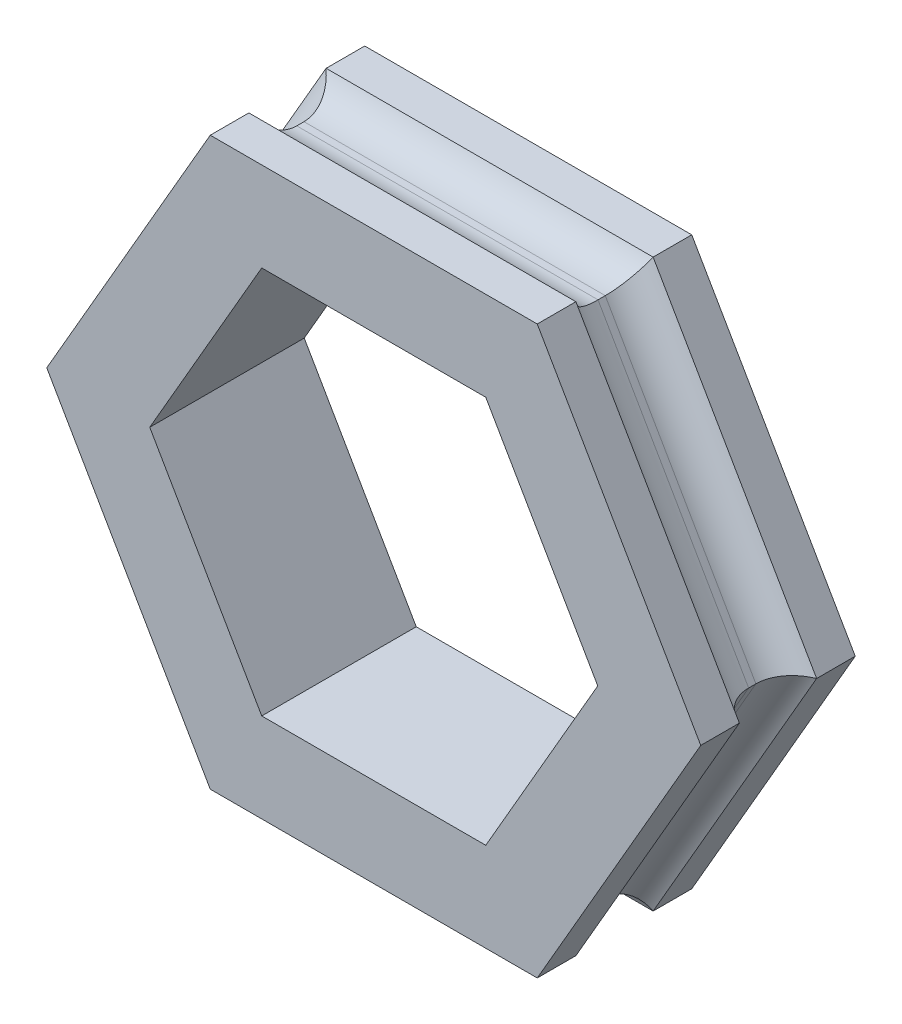
from build123d import *

# Parameters (mm, degrees)
BOSS_EXTRUDE2_DEPTH      = 1.5
BOSS_EXTRUDE2_DEPTH_BACK = 1.5
CUT_EXTRUDE1_DEPTH       = 0.75
CUT_EXTRUDE1_DEPTH_BACK  = 0.75
FILLET1_R                = 0.75


with BuildPart() as part:
    # Sketch1 → Boss-Extrude2 (new, two sides: drawn at the far end of the back side and taken through both)
    # profile 1 of 2: a face of its own
    with BuildSketch(Plane.XY.offset(-BOSS_EXTRUDE2_DEPTH_BACK)):
        Polygon((-3.175, -5.499261314), (3.175, -5.499261314), (6.35, 0), (3.175, 5.499261314), (-3.175, 5.499261314), (-6.35, 0), align=None)
        Polygon((2.925, -5.066248612), (5.85, 0), (2.925, 5.066248612), (-2.925, 5.066248612), (-5.85, 0), (-2.925, -5.066248612), align=None, mode=Mode.SUBTRACT)
    # profile 2 of 2: a face of its own
    with BuildSketch(Plane.XY.offset(-BOSS_EXTRUDE2_DEPTH_BACK)):
        Polygon((-2.925, -5.066248612), (2.925, -5.066248612), (5.85, 0), (2.925, 5.066248612), (-2.925, 5.066248612), (-5.85, 0), align=None)
        Polygon((2.175, -3.767210506), (4.35, 0), (2.175, 3.767210506), (-2.175, 3.767210506), (-4.35, 0), (-2.175, -3.767210506), align=None, mode=Mode.SUBTRACT)
    extrude(amount=BOSS_EXTRUDE2_DEPTH + BOSS_EXTRUDE2_DEPTH_BACK)

    # Sketch1<4> → Cut-Extrude1 (cut, two sides: drawn at the far end of the back side and taken through both)
    with BuildSketch(Plane.XY.offset(-CUT_EXTRUDE1_DEPTH_BACK)):
        Polygon((-3.175, -5.499261314), (3.175, -5.499261314), (6.35, 0), (3.175, 5.499261314), (-3.175, 5.499261314), (-6.35, 0), align=None)
        Polygon((2.925, -5.066248612), (5.85, 0), (2.925, 5.066248612), (-2.925, 5.066248612), (-5.85, 0), (-2.925, -5.066248612), align=None, mode=Mode.SUBTRACT)
    extrude(amount=CUT_EXTRUDE1_DEPTH + CUT_EXTRUDE1_DEPTH_BACK, mode=Mode.SUBTRACT)

    # Fillet1
    # the kernel refuses this fillet: 0.75 mm, written as the material it adds along each edge
    with BuildSketch(Plane(origin=(2.075350207, -6.537885222, 0.75), x_dir=(0.8660254037844385, -0.5000000000000001, 0), z_dir=(0.5000000000000001, 0.8660254037844387, 0))) as fillet1_piece_1_section:
        with BuildLine():
            CenterArc((0.75, 0.679719834), FILLET1_R, 180, 64.998010544)
            Line((0, 0.679719834), (0, 0))
            Line((0, 0), (0.433012702, 0))
        make_face()
    fillet1_piece_1 = extrude(amount=9.24859917, mode=Mode.PRIVATE)
    fillet1_piece_1 = split(fillet1_piece_1, bisect_by=Plane(origin=(2.075350207, -5.499261314, 0.75), z_dir=(0, 1, 0)), keep=Keep.TOP, mode=Mode.PRIVATE)
    fillet1_piece_1 = split(fillet1_piece_1, bisect_by=Plane(origin=(8.112324896, -3.05243626, 0.75), z_dir=(-0.8660254037844386, -0.5000000000000002, 0)), keep=Keep.TOP, mode=Mode.PRIVATE)
    fillet1_piece_1 = fillet1_piece_1 - Plane(origin=(2.075350207, -5.816248612, 0.070280166), x_dir=(0, 0.42264973081037627, 0.9062931121033175), z_dir=(-1, 0, 0)) * Cylinder(0.75, 22, mode=Mode.PRIVATE)
    fillet1_piece_1 = fillet1_piece_1 - Plane(origin=(8.386843949, -2.893942611, 0.070280166), x_dir=(-0.3660254037844377, -0.21132486540518658, 0.9062931121033191), z_dir=(0.5000000000000001, -0.8660254037844386, 0)) * Cylinder(0.75, 22, mode=Mode.PRIVATE)
    add(fillet1_piece_1)
    with BuildSketch(Plane(origin=(-4.624299585, -5.066248612, 0.75), x_dir=(0, -1, 0), z_dir=(1, 0, 0))) as fillet1_piece_2_section:
        with BuildLine():
            CenterArc((0.75, 0.679719834), FILLET1_R, 180, 64.998010544)
            Line((0, 0.679719834), (0, 0))
            Line((0, 0), (0.433012702, 0))
        make_face()
    fillet1_piece_2 = extrude(amount=9.24859917, mode=Mode.PRIVATE)
    fillet1_piece_2 = split(fillet1_piece_2, bisect_by=Plane(origin=(-3.724824896, -4.546936658, 0.75), z_dir=(0.8660254037844386, 0.5000000000000001, 0)), keep=Keep.TOP, mode=Mode.PRIVATE)
    fillet1_piece_2 = split(fillet1_piece_2, bisect_by=Plane(origin=(1.412675104, -8.551697574, 0.75), z_dir=(-0.8660254037844389, 0.4999999999999995, 0)), keep=Keep.TOP, mode=Mode.PRIVATE)
    fillet1_piece_2 = fillet1_piece_2 - Plane(origin=(1.687194157, -8.710191223, 0.070280166), x_dir=(-0.3660254037844373, 0.21132486540518636, 0.9062931121033192), z_dir=(-0.5000000000000001, -0.8660254037844386, 0)) * Cylinder(0.75, 22, mode=Mode.PRIVATE)
    fillet1_piece_2 = fillet1_piece_2 - Plane(origin=(-3.999343949, -4.705430307, 0.070280166), x_dir=(0.3660254037844385, 0.21132486540518705, 0.9062931121033185), z_dir=(-0.5000000000000001, 0.8660254037844386, 0)) * Cylinder(0.75, 22, mode=Mode.PRIVATE)
    add(fillet1_piece_2)
    with BuildSketch(Plane(origin=(-6.699649793, 1.471636609, 0.75), x_dir=(-0.8660254037844386, -0.5000000000000001, 0), z_dir=(0.5000000000000001, -0.8660254037844387, 0))) as fillet1_piece_3_section:
        with BuildLine():
            CenterArc((0.75, 0.679719834), FILLET1_R, 180, 64.998010544)
            Line((0, 0.679719834), (0, 0))
            Line((0, 0), (0.433012702, 0))
        make_face()
    fillet1_piece_3 = extrude(amount=9.24859917, mode=Mode.PRIVATE)
    fillet1_piece_3 = split(fillet1_piece_3, bisect_by=Plane(origin=(-6.699649793, -5.499261314, 0.75), z_dir=(0, 1, 0)), keep=Keep.TOP, mode=Mode.PRIVATE)
    fillet1_piece_3 = split(fillet1_piece_3, bisect_by=Plane(origin=(-5.800175104, 0.952324656, 0.75), z_dir=(0.8660254037844388, -0.4999999999999999, 0)), keep=Keep.TOP, mode=Mode.PRIVATE)
    fillet1_piece_3 = fillet1_piece_3 - Plane(origin=(-6.699649793, -5.816248612, 0.070280166), x_dir=(0, 0.42264973081037627, 0.9062931121033175), z_dir=(-1, 0, 0)) * Cylinder(0.75, 22, mode=Mode.PRIVATE)
    fillet1_piece_3 = fillet1_piece_3 - Plane(origin=(-6.074694157, 1.110818305, 0.070280166), x_dir=(0.36602540378443843, -0.21132486540518683, 0.9062931121033186), z_dir=(0.49999999999999967, 0.8660254037844388, 0)) * Cylinder(0.75, 22, mode=Mode.PRIVATE)
    add(fillet1_piece_3)
    with BuildSketch(Plane(origin=(-2.075350207, 6.537885222, 0.75), x_dir=(-0.8660254037844388, 0.49999999999999967, 0), z_dir=(-0.4999999999999997, -0.8660254037844388, 0))) as fillet1_piece_4_section:
        with BuildLine():
            CenterArc((0.75, 0.679719834), FILLET1_R, 180, 64.998010544)
            Line((0, 0.679719834), (0, 0))
            Line((0, 0), (0.433012702, 0))
        make_face()
    fillet1_piece_4 = extrude(amount=9.24859917, mode=Mode.PRIVATE)
    fillet1_piece_4 = split(fillet1_piece_4, bisect_by=Plane(origin=(-8.112324896, 3.05243626, 0.75), z_dir=(0.8660254037844386, 0.5000000000000001, 0)), keep=Keep.TOP, mode=Mode.PRIVATE)
    fillet1_piece_4 = split(fillet1_piece_4, bisect_by=Plane(origin=(-2.075350207, 5.499261314, 0.75), z_dir=(0, -1, 0)), keep=Keep.TOP, mode=Mode.PRIVATE)
    fillet1_piece_4 = fillet1_piece_4 - Plane(origin=(-8.386843949, 2.893942611, 0.070280166), x_dir=(0.3660254037844385, 0.21132486540518705, 0.9062931121033185), z_dir=(-0.5000000000000001, 0.8660254037844386, 0)) * Cylinder(0.75, 22, mode=Mode.PRIVATE)
    fillet1_piece_4 = fillet1_piece_4 - Plane(origin=(-2.075350207, 5.816248612, 0.070280166), x_dir=(0, -0.42264973081036916, 0.9062931121033209), z_dir=(1, 0, 0)) * Cylinder(0.75, 22, mode=Mode.PRIVATE)
    add(fillet1_piece_4)
    with BuildSketch(Plane(origin=(4.624299585, 5.066248612, 0.75), x_dir=(0, 1, 0), z_dir=(-1, 0, 0))) as fillet1_piece_5_section:
        with BuildLine():
            CenterArc((0.75, 0.679719834), FILLET1_R, 180, 64.998010544)
            Line((0, 0.679719834), (0, 0))
            Line((0, 0), (0.433012702, 0))
        make_face()
    fillet1_piece_5 = extrude(amount=9.24859917, mode=Mode.PRIVATE)
    fillet1_piece_5 = split(fillet1_piece_5, bisect_by=Plane(origin=(-1.412675104, 8.551697574, 0.75), z_dir=(0.8660254037844388, -0.4999999999999999, 0)), keep=Keep.TOP, mode=Mode.PRIVATE)
    fillet1_piece_5 = split(fillet1_piece_5, bisect_by=Plane(origin=(3.724824896, 4.546936658, 0.75), z_dir=(-0.8660254037844386, -0.5000000000000002, 0)), keep=Keep.TOP, mode=Mode.PRIVATE)
    fillet1_piece_5 = fillet1_piece_5 - Plane(origin=(-1.687194157, 8.710191223, 0.070280166), x_dir=(0.36602540378443843, -0.21132486540518683, 0.9062931121033186), z_dir=(0.49999999999999967, 0.8660254037844388, 0)) * Cylinder(0.75, 22, mode=Mode.PRIVATE)
    fillet1_piece_5 = fillet1_piece_5 - Plane(origin=(3.999343949, 4.705430307, 0.070280166), x_dir=(-0.3660254037844377, -0.21132486540518658, 0.9062931121033191), z_dir=(0.5000000000000001, -0.8660254037844386, 0)) * Cylinder(0.75, 22, mode=Mode.PRIVATE)
    add(fillet1_piece_5)
    with BuildSketch(Plane(origin=(6.699649793, -1.471636609, 0.75), x_dir=(0.8660254037844386, 0.5000000000000001, 0), z_dir=(-0.5000000000000001, 0.8660254037844387, 0))) as fillet1_piece_6_section:
        with BuildLine():
            CenterArc((0.75, 0.679719834), FILLET1_R, 180, 64.998010544)
            Line((0, 0.679719834), (0, 0))
            Line((0, 0), (0.433012702, 0))
        make_face()
    fillet1_piece_6 = extrude(amount=9.24859917, mode=Mode.PRIVATE)
    fillet1_piece_6 = split(fillet1_piece_6, bisect_by=Plane(origin=(5.800175104, -0.952324656, 0.75), z_dir=(-0.8660254037844389, 0.4999999999999995, 0)), keep=Keep.TOP, mode=Mode.PRIVATE)
    fillet1_piece_6 = split(fillet1_piece_6, bisect_by=Plane(origin=(6.699649793, 5.499261314, 0.75), z_dir=(0, -1, 0)), keep=Keep.TOP, mode=Mode.PRIVATE)
    fillet1_piece_6 = fillet1_piece_6 - Plane(origin=(6.074694157, -1.110818305, 0.070280166), x_dir=(-0.3660254037844373, 0.21132486540518636, 0.9062931121033192), z_dir=(-0.5000000000000001, -0.8660254037844386, 0)) * Cylinder(0.75, 22, mode=Mode.PRIVATE)
    fillet1_piece_6 = fillet1_piece_6 - Plane(origin=(6.699649793, 5.816248612, 0.070280166), x_dir=(0, -0.42264973081036916, 0.9062931121033209), z_dir=(1, 0, 0)) * Cylinder(0.75, 22, mode=Mode.PRIVATE)
    add(fillet1_piece_6)
    with BuildSketch(Plane(origin=(2.075350207, -6.537885222, -0.75), x_dir=(0, 0, 1), z_dir=(0.5000000000000001, 0.8660254037844387, 0))) as fillet1_piece_7_section:
        with BuildLine():
            CenterArc((0.679719834, 0.75), FILLET1_R, 205.001989456, 64.998010544)
            Line((0, 0.433012702), (0, 0))
            Line((0, 0), (0.679719834, 0))
        make_face()
    fillet1_piece_7 = extrude(amount=9.24859917, mode=Mode.PRIVATE)
    fillet1_piece_7 = split(fillet1_piece_7, bisect_by=Plane(origin=(2.075350207, -5.499261314, -0.75), z_dir=(0, 1, 0)), keep=Keep.TOP, mode=Mode.PRIVATE)
    fillet1_piece_7 = split(fillet1_piece_7, bisect_by=Plane(origin=(8.112324896, -3.05243626, -0.75), z_dir=(-0.8660254037844386, -0.5000000000000002, 0)), keep=Keep.TOP, mode=Mode.PRIVATE)
    fillet1_piece_7 = fillet1_piece_7 - Plane(origin=(8.386843949, -2.893942611, -0.070280166), x_dir=(-0.8660254037844387, -0.5000000000000001, 0), z_dir=(0.5000000000000001, -0.8660254037844387, 0)) * Cylinder(0.75, 22, mode=Mode.PRIVATE)
    fillet1_piece_7 = fillet1_piece_7 - Plane(origin=(2.075350207, -5.816248612, -0.070280166), x_dir=(0, 1, 0), z_dir=(-1, 0, 0)) * Cylinder(0.75, 22, mode=Mode.PRIVATE)
    add(fillet1_piece_7)
    with BuildSketch(Plane(origin=(6.699649793, -1.471636609, -0.75), x_dir=(0, 0, 1), z_dir=(-0.5000000000000001, 0.8660254037844387, 0))) as fillet1_piece_8_section:
        with BuildLine():
            CenterArc((0.679719834, 0.75), FILLET1_R, 205.001989456, 64.998010544)
            Line((0, 0.433012702), (0, 0))
            Line((0, 0), (0.679719834, 0))
        make_face()
    fillet1_piece_8 = extrude(amount=9.24859917, mode=Mode.PRIVATE)
    fillet1_piece_8 = split(fillet1_piece_8, bisect_by=Plane(origin=(5.800175104, -0.952324656, -0.75), z_dir=(-0.8660254037844389, 0.4999999999999995, 0)), keep=Keep.TOP, mode=Mode.PRIVATE)
    fillet1_piece_8 = split(fillet1_piece_8, bisect_by=Plane(origin=(6.699649793, 5.499261314, -0.75), z_dir=(0, -1, 0)), keep=Keep.TOP, mode=Mode.PRIVATE)
    fillet1_piece_8 = fillet1_piece_8 - Plane(origin=(6.074694157, -1.110818305, -0.070280166), x_dir=(-0.8660254037844387, 0.5000000000000001, 0), z_dir=(-0.5000000000000001, -0.8660254037844387, 0)) * Cylinder(0.75, 22, mode=Mode.PRIVATE)
    fillet1_piece_8 = fillet1_piece_8 - Plane(origin=(6.699649793, 5.816248612, -0.070280166), x_dir=(0, -1, 0), z_dir=(1, 0, 0)) * Cylinder(0.75, 22, mode=Mode.PRIVATE)
    add(fillet1_piece_8)
    with BuildSketch(Plane(origin=(4.624299585, 5.066248612, -0.75), x_dir=(0, 0, 1), z_dir=(-1, 0, 0))) as fillet1_piece_9_section:
        with BuildLine():
            CenterArc((0.679719834, 0.75), FILLET1_R, 205.001989456, 64.998010544)
            Line((0, 0.433012702), (0, 0))
            Line((0, 0), (0.679719834, 0))
        make_face()
    fillet1_piece_9 = extrude(amount=9.24859917, mode=Mode.PRIVATE)
    fillet1_piece_9 = split(fillet1_piece_9, bisect_by=Plane(origin=(3.724824896, 4.546936658, -0.75), z_dir=(-0.8660254037844386, -0.5000000000000002, 0)), keep=Keep.TOP, mode=Mode.PRIVATE)
    fillet1_piece_9 = split(fillet1_piece_9, bisect_by=Plane(origin=(-1.412675104, 8.551697574, -0.75), z_dir=(0.8660254037844388, -0.4999999999999999, 0)), keep=Keep.TOP, mode=Mode.PRIVATE)
    fillet1_piece_9 = fillet1_piece_9 - Plane(origin=(-1.687194157, 8.710191223, -0.070280166), x_dir=(0.8660254037844388, -0.4999999999999997, 0), z_dir=(0.4999999999999997, 0.8660254037844388, 0)) * Cylinder(0.75, 22, mode=Mode.PRIVATE)
    fillet1_piece_9 = fillet1_piece_9 - Plane(origin=(3.999343949, 4.705430307, -0.070280166), x_dir=(-0.8660254037844387, -0.5000000000000001, 0), z_dir=(0.5000000000000001, -0.8660254037844387, 0)) * Cylinder(0.75, 22, mode=Mode.PRIVATE)
    add(fillet1_piece_9)
    with BuildSketch(Plane(origin=(-2.075350207, 6.537885222, -0.75), x_dir=(0, 0, 1), z_dir=(-0.4999999999999997, -0.8660254037844388, 0))) as fillet1_piece_10_section:
        with BuildLine():
            CenterArc((0.679719834, 0.75), FILLET1_R, 205.001989456, 64.998010544)
            Line((0, 0.433012702), (0, 0))
            Line((0, 0), (0.679719834, 0))
        make_face()
    fillet1_piece_10 = extrude(amount=9.24859917, mode=Mode.PRIVATE)
    fillet1_piece_10 = split(fillet1_piece_10, bisect_by=Plane(origin=(-2.075350207, 5.499261314, -0.75), z_dir=(0, -1, 0)), keep=Keep.TOP, mode=Mode.PRIVATE)
    fillet1_piece_10 = split(fillet1_piece_10, bisect_by=Plane(origin=(-8.112324896, 3.05243626, -0.75), z_dir=(0.8660254037844386, 0.5000000000000001, 0)), keep=Keep.TOP, mode=Mode.PRIVATE)
    fillet1_piece_10 = fillet1_piece_10 - Plane(origin=(-8.386843949, 2.893942611, -0.070280166), x_dir=(0.8660254037844387, 0.5000000000000001, 0), z_dir=(-0.5000000000000001, 0.8660254037844387, 0)) * Cylinder(0.75, 22, mode=Mode.PRIVATE)
    fillet1_piece_10 = fillet1_piece_10 - Plane(origin=(-2.075350207, 5.816248612, -0.070280166), x_dir=(0, -1, 0), z_dir=(1, 0, 0)) * Cylinder(0.75, 22, mode=Mode.PRIVATE)
    add(fillet1_piece_10)
    with BuildSketch(Plane(origin=(-6.699649793, 1.471636609, -0.75), x_dir=(0, 0, 1), z_dir=(0.5000000000000001, -0.8660254037844387, 0))) as fillet1_piece_11_section:
        with BuildLine():
            CenterArc((0.679719834, 0.75), FILLET1_R, 205.001989456, 64.998010544)
            Line((0, 0.433012702), (0, 0))
            Line((0, 0), (0.679719834, 0))
        make_face()
    fillet1_piece_11 = extrude(amount=9.24859917, mode=Mode.PRIVATE)
    fillet1_piece_11 = split(fillet1_piece_11, bisect_by=Plane(origin=(-6.699649793, -5.499261314, -0.75), z_dir=(0, 1, 0)), keep=Keep.TOP, mode=Mode.PRIVATE)
    fillet1_piece_11 = split(fillet1_piece_11, bisect_by=Plane(origin=(-5.800175104, 0.952324656, -0.75), z_dir=(0.8660254037844388, -0.4999999999999999, 0)), keep=Keep.TOP, mode=Mode.PRIVATE)
    fillet1_piece_11 = fillet1_piece_11 - Plane(origin=(-6.074694157, 1.110818305, -0.070280166), x_dir=(0.8660254037844388, -0.4999999999999997, 0), z_dir=(0.4999999999999997, 0.8660254037844388, 0)) * Cylinder(0.75, 22, mode=Mode.PRIVATE)
    fillet1_piece_11 = fillet1_piece_11 - Plane(origin=(-6.699649793, -5.816248612, -0.070280166), x_dir=(0, 1, 0), z_dir=(-1, 0, 0)) * Cylinder(0.75, 22, mode=Mode.PRIVATE)
    add(fillet1_piece_11)
    with BuildSketch(Plane(origin=(-4.624299585, -5.066248612, -0.75), x_dir=(0, 0, 1), z_dir=(1, 0, 0))) as fillet1_piece_12_section:
        with BuildLine():
            CenterArc((0.679719834, 0.75), FILLET1_R, 205.001989456, 64.998010544)
            Line((0, 0.433012702), (0, 0))
            Line((0, 0), (0.679719834, 0))
        make_face()
    fillet1_piece_12 = extrude(amount=9.24859917, mode=Mode.PRIVATE)
    fillet1_piece_12 = split(fillet1_piece_12, bisect_by=Plane(origin=(1.412675104, -8.551697574, -0.75), z_dir=(-0.8660254037844389, 0.4999999999999995, 0)), keep=Keep.TOP, mode=Mode.PRIVATE)
    fillet1_piece_12 = split(fillet1_piece_12, bisect_by=Plane(origin=(-3.724824896, -4.546936658, -0.75), z_dir=(0.8660254037844386, 0.5000000000000001, 0)), keep=Keep.TOP, mode=Mode.PRIVATE)
    fillet1_piece_12 = fillet1_piece_12 - Plane(origin=(-3.999343949, -4.705430307, -0.070280166), x_dir=(0.8660254037844387, 0.5000000000000001, 0), z_dir=(-0.5000000000000001, 0.8660254037844387, 0)) * Cylinder(0.75, 22, mode=Mode.PRIVATE)
    fillet1_piece_12 = fillet1_piece_12 - Plane(origin=(1.687194157, -8.710191223, -0.070280166), x_dir=(-0.8660254037844387, 0.5000000000000001, 0), z_dir=(-0.5000000000000001, -0.8660254037844387, 0)) * Cylinder(0.75, 22, mode=Mode.PRIVATE)
    add(fillet1_piece_12)


solid = part.part
